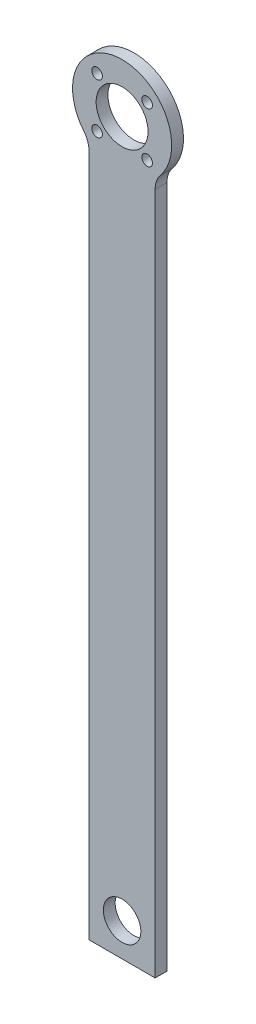
from build123d import *

# Parameters (mm, degrees)
SKETCH1_W              = 5
SKETCH1_H              = 330
BOSS_EXTRUDE1_DEPTH    = 42
CUT_EXTRUDE1_START     = -5
CUT_EXTRUDE1_OUTLINE_R = 11
CUT_EXTRUDE1_DEPTH     = 5
M4_CLEARANCE_HOLE1_D   = 4.5
CUT_EXTRUDE3_DEPTH     = 5
FILLET2_R              = 10
SKETCH10_R             = 7.9375
CUT_EXTRUDE4_DEPTH     = 5


# Read off the part's stored shape, not the designer's step: Cut-Extrude1
with BuildPart() as part:
    # Sketch1 → Boss-Extrude1 (new body)
    with BuildSketch(Plane(origin=(0, 0, 0), x_dir=(0, 0, -1), z_dir=(1, 0, 0))):
        with Locations((-2.5, 165)):
            Rectangle(SKETCH1_W, SKETCH1_H)
    extrude(amount=BOSS_EXTRUDE1_DEPTH)

    # Cut-Extrude1 outline → Cut-Extrude1 (cut)
    with BuildSketch(Plane.XY.offset(5).offset(CUT_EXTRUDE1_START)):
        with BuildLine():
            ThreePointArc((0, 309), (6.150757595, 323.849242405), (21, 330))
            Line((21, 330), (0, 330))
            Line((0, 330), (0, 309))
        make_face()
        with BuildLine():
            ThreePointArc((21, 330), (35.849242405, 323.849242405), (42, 309))
            Line((42, 309), (42, 330))
            Line((42, 330), (21, 330))
        make_face()
        with Locations((21, 309)):
            Circle(CUT_EXTRUDE1_OUTLINE_R)
    extrude(amount=CUT_EXTRUDE1_DEPTH, mode=Mode.SUBTRACT)

    # M4 Clearance Hole1 (through all)
    with Locations(Plane.XY.offset(5)):
        with Locations((10.393398282, 319.606601718), (31.606601718, 319.606601718), (31.606601718, 298.393398282), (10.393398282, 298.393398282)):
            Hole(M4_CLEARANCE_HOLE1_D / 2)

    # Sketch9 → Cut-Extrude3 (cut)
    with BuildSketch(Plane(origin=(0, 0, 0), x_dir=(-1, 0, 0), z_dir=(0, 0, -1))):
        with BuildLine():
            Line((-35, 293.347524158), (-35, 0))
            Line((-35, 0), (-42, 0))
            Line((-42, 0), (-42, 309))
            ThreePointArc((-42, 309), (-40.170289513, 300.4267859), (-35, 293.347524158))
        make_face()
        with BuildLine():
            Line((-7, 0), (-7, 293.347524158))
            ThreePointArc((-7, 293.347524158), (-1.829710487, 300.4267859), (0, 309))
            Line((0, 309), (0, 0))
            Line((0, 0), (-7, 0))
        make_face()
    extrude(amount=-CUT_EXTRUDE3_DEPTH, mode=Mode.SUBTRACT)

    # Fillet2
    fillet2_edges = [part.edges().sort_by_distance(p)[0] for p in [
        (35, 293.347524158, 2.5),
        (7, 293.347524158, 2.5),
    ]]
    fillet(fillet2_edges, radius=FILLET2_R)

    # Sketch10 → Cut-Extrude4 (cut)
    with BuildSketch(Plane(origin=(0, 0, 0), x_dir=(-1, 0, 0), z_dir=(0, 0, -1))):
        with Locations(Location((-21, 14, 0), (0, 0, 90))):
            Circle(SKETCH10_R)
    extrude(amount=-CUT_EXTRUDE4_DEPTH, mode=Mode.SUBTRACT)


solid = part.part
